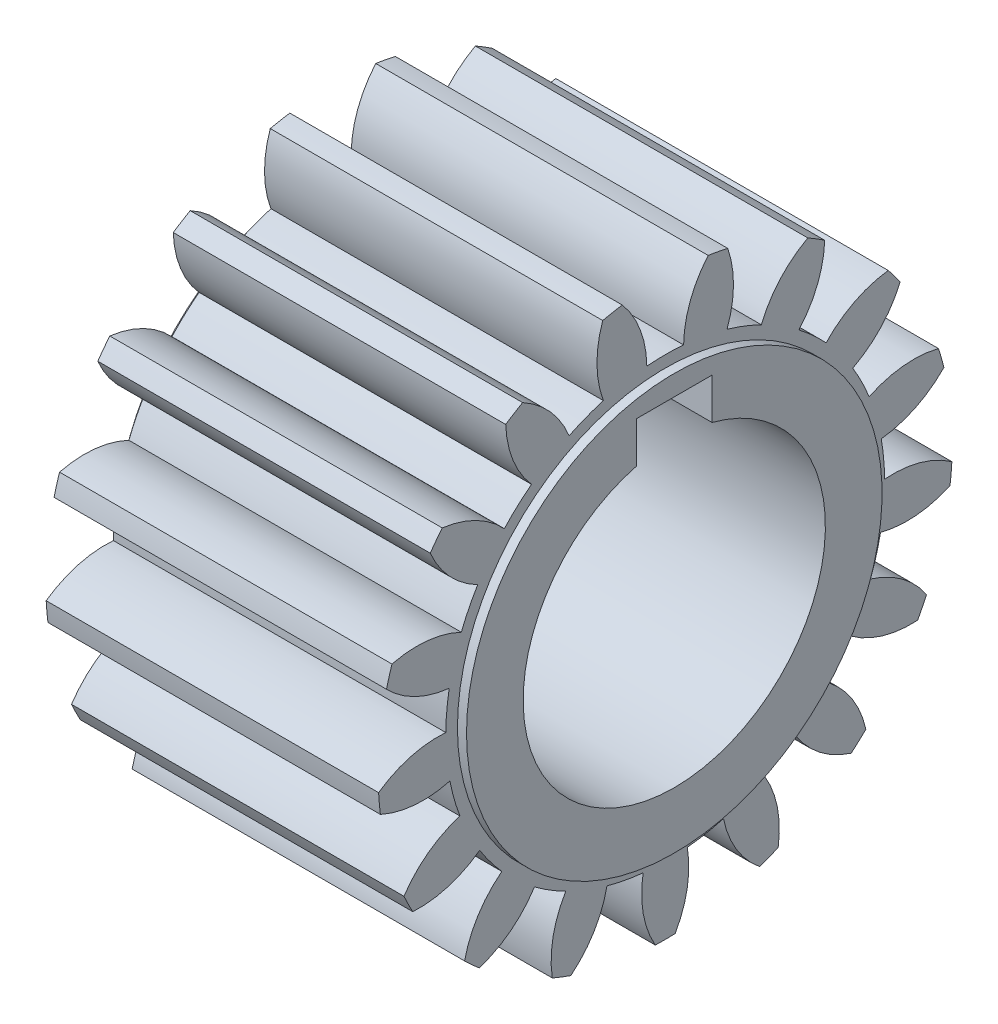
from build123d import *

# Parameters (mm, degrees)
SPUR_START          = 60.68508869
SPUR_GEAR_AI_DEPTH  = 13.97
SKETCH1_R           = 8.73125
BOSS_EXTRUDE1_DEPTH = 0.381
BOSS_EXTRUDE2_START = 0.381
SKETCH2_R           = 8.73125
BOSS_EXTRUDE2_DEPTH = 0.381


# Read off the part's stored shape, not the designer's step: spur gear_ai
with BuildPart() as part:
    # spur gear_ai outline → spur gear_ai (new body)
    with BuildSketch(Plane.YZ.offset(SPUR_START)):
        with BuildLine():
            ThreePointArc((-11.323917399, -24.217086363), (-11.097675416, -23.865456059), (-10.883753605, -23.506197427))
            ThreePointArc((-10.883753605, -23.506197427), (-11.804950291, -22.339121223), (-13.067398654, -21.553695012))
            ThreePointArc((-13.067398654, -21.553695012), (-12.757964709, -20.844772424), (-12.509041094, -20.112408009))
            ThreePointArc((-12.509041094, -20.112408009), (-11.04694228, -20.382476998), (-9.57991556, -20.14060347))
            ThreePointArc((-9.57991556, -20.14060347), (-9.495974711, -19.730989946), (-9.42627775, -19.318713778))
            ThreePointArc((-9.42627775, -19.318713778), (-10.70686463, -18.563222253), (-12.167791342, -18.286883074))
            ThreePointArc((-12.167791342, -18.286883074), (-12.135345159, -17.514052013), (-12.167791342, -16.741220953))
            ThreePointArc((-12.167791342, -16.741220953), (-10.70686463, -16.464881774), (-9.42627775, -15.709390249))
            ThreePointArc((-9.42627775, -15.709390249), (-9.495974711, -15.297114081), (-9.57991556, -14.887500557))
            ThreePointArc((-9.57991556, -14.887500557), (-11.04694228, -14.645627029), (-12.509041094, -14.915696018))
            ThreePointArc((-12.509041094, -14.915696018), (-12.757964709, -14.183331603), (-13.067398654, -13.474409015))
            ThreePointArc((-13.067398654, -13.474409015), (-11.804950291, -12.688982804), (-10.883753605, -11.5219066))
            ThreePointArc((-10.883753605, -11.5219066), (-11.097675416, -11.162647968), (-11.323917399, -10.811017664))
            ThreePointArc((-11.323917399, -10.811017664), (-12.779253872, -11.115428493), (-14.045060241, -11.895431337))
            ThreePointArc((-14.045060241, -11.895431337), (-14.54173514, -11.302443439), (-15.086366078, -10.753173247))
            ThreePointArc((-15.086366078, -10.753173247), (-14.192896711, -9.564736168), (-13.755502936, -8.143695392))
            ThreePointArc((-13.755502936, -8.143695392), (-14.084758271, -7.885974166), (-14.422746154, -7.639816704))
            ThreePointArc((-14.422746154, -7.639816704), (-15.669841124, -8.44939952), (-16.568400884, -9.633992513))
            ThreePointArc((-16.568400884, -9.633992513), (-17.245748371, -9.260467435), (-17.952020875, -8.945031621))
            ThreePointArc((-17.952020875, -8.945031621), (-17.548198493, -7.514088685), (-17.653680083, -6.031002769))
            ThreePointArc((-17.653680083, -6.031002769), (-18.053801184, -5.909625629), (-18.45788783, -5.802185936))
            ThreePointArc((-18.45788783, -5.802185936), (-19.328314212, -7.007602095), (-19.738271888, -8.436799389))
            ThreePointArc((-19.738271888, -8.436799389), (-20.504812431, -8.333183761), (-21.277340486, -8.294183681))
            ThreePointArc((-21.277340486, -8.294183681), (-21.41770354, -6.813991662), (-22.051814621, -5.469159576))
            ThreePointArc((-22.051814621, -5.469159576), (-22.468762916, -5.500519177), (-22.884374185, -5.546307581))
            ThreePointArc((-22.884374185, -5.546307581), (-23.260576072, -6.98475895), (-23.126564609, -8.465539531))
            ThreePointArc((-23.126564609, -8.465539531), (-23.87877266, -8.645827218), (-24.613222072, -8.888530048))
            ThreePointArc((-24.613222072, -8.888530048), (-25.278813753, -7.55899708), (-26.355914109, -6.53404585))
            ThreePointArc((-26.355914109, -6.53404585), (-26.733378421, -6.713906903), (-27.104383709, -6.906739426))
            ThreePointArc((-27.104383709, -6.906739426), (-26.935552952, -8.383955178), (-26.275671339, -9.716331423))
            ThreePointArc((-26.275671339, -9.716331423), (-26.911957033, -10.156173575), (-27.509136339, -10.647800953))
            ThreePointArc((-27.509136339, -10.647800953), (-28.610064803, -9.648487829), (-29.984686063, -9.081842798))
            ThreePointArc((-29.984686063, -9.081842798), (-30.271687745, -9.385914073), (-30.547980731, -9.699747614))
            ThreePointArc((-30.547980731, -9.699747614), (-29.856918859, -11.016221575), (-28.760287766, -12.020248689))
            ThreePointArc((-28.760287766, -12.020248689), (-29.194717194, -12.660242185), (-29.573974019, -13.33439711))
            ThreePointArc((-29.573974019, -13.33439711), (-30.961552776, -12.800266607), (-32.448044722, -12.768456326))
            ThreePointArc((-32.448044722, -12.768456326), (-32.605822607, -13.155671311), (-32.750088392, -13.548120911))
            ThreePointArc((-32.750088392, -13.548120911), (-31.63012714, -14.526055979), (-30.244852672, -15.066134537))
            ThreePointArc((-30.244852672, -15.066134537), (-30.418753733, -15.819844709), (-30.528867342, -16.585478823))
            ThreePointArc((-30.528867342, -16.585478823), (-32.015696192, -16.588668223), (-33.41329985, -17.095988847))
            ThreePointArc((-33.41329985, -17.095988847), (-33.420545159, -17.514052013), (-33.41329985, -17.93211518))
            ThreePointArc((-33.41329985, -17.93211518), (-32.015696192, -18.439435804), (-30.528867342, -18.442625204))
            ThreePointArc((-30.528867342, -18.442625204), (-30.418753733, -19.208259318), (-30.244852672, -19.96196949))
            ThreePointArc((-30.244852672, -19.96196949), (-31.63012714, -20.502048048), (-32.750088392, -21.479983116))
            ThreePointArc((-32.750088392, -21.479983116), (-32.605822607, -21.872432716), (-32.448044722, -22.259647701))
            ThreePointArc((-32.448044722, -22.259647701), (-30.961552776, -22.22783742), (-29.573974019, -21.693706917))
            ThreePointArc((-29.573974019, -21.693706917), (-29.194717194, -22.367861842), (-28.760287766, -23.007855338))
            ThreePointArc((-28.760287766, -23.007855338), (-29.856918859, -24.011882452), (-30.547980731, -25.328356413))
            ThreePointArc((-30.547980731, -25.328356413), (-30.271687745, -25.642189954), (-29.984686063, -25.946261229))
            ThreePointArc((-29.984686063, -25.946261229), (-28.610064803, -25.379616198), (-27.509136339, -24.380303074))
            ThreePointArc((-27.509136339, -24.380303074), (-26.911957033, -24.871930452), (-26.275671339, -25.311772604))
            ThreePointArc((-26.275671339, -25.311772604), (-26.935552952, -26.644148849), (-27.104383709, -28.121364601))
            ThreePointArc((-27.104383709, -28.121364601), (-26.733378421, -28.314197124), (-26.355914109, -28.494058177))
            ThreePointArc((-26.355914109, -28.494058177), (-25.278813753, -27.469106947), (-24.613222072, -26.139573979))
            ThreePointArc((-24.613222072, -26.139573979), (-23.87877266, -26.382276809), (-23.126564609, -26.562564496))
            ThreePointArc((-23.126564609, -26.562564496), (-23.260576072, -28.043345077), (-22.884374185, -29.481796446))
            ThreePointArc((-22.884374185, -29.481796446), (-22.468762916, -29.527584851), (-22.051814621, -29.558944451))
            ThreePointArc((-22.051814621, -29.558944451), (-21.41770354, -28.214112365), (-21.277340486, -26.733920346))
            ThreePointArc((-21.277340486, -26.733920346), (-20.504812431, -26.694920266), (-19.738271888, -26.591304638))
            ThreePointArc((-19.738271888, -26.591304638), (-19.328314212, -28.020501932), (-18.45788783, -29.225918091))
            ThreePointArc((-18.45788783, -29.225918091), (-18.053801184, -29.118478398), (-17.653680083, -28.997101258))
            ThreePointArc((-17.653680083, -28.997101258), (-17.548198493, -27.514015342), (-17.952020875, -26.083072406))
            ThreePointArc((-17.952020875, -26.083072406), (-17.245748371, -25.767636592), (-16.568400884, -25.394111514))
            ThreePointArc((-16.568400884, -25.394111514), (-15.669841124, -26.578704507), (-14.422746154, -27.388287323))
            ThreePointArc((-14.422746154, -27.388287323), (-14.084758271, -27.142129861), (-13.755502936, -26.884408635))
            ThreePointArc((-13.755502936, -26.884408635), (-14.192896711, -25.463367859), (-15.086366078, -24.27493078))
            ThreePointArc((-15.086366078, -24.27493078), (-14.54173514, -23.725660588), (-14.045060241, -23.13267269))
            ThreePointArc((-14.045060241, -23.13267269), (-12.779253872, -23.912675534), (-11.323917399, -24.217086363))
        make_face()
        with BuildLine():
            Line((-13.481545159, -19.101552014), (-15.207184097, -19.101552014))
            ThreePointArc((-15.207184097, -19.101552014), (-27.705545159, -17.514052014), (-15.207184097, -15.926552014))
            Line((-15.207184097, -15.926552014), (-13.481545159, -15.926552014))
            Line((-13.481545159, -15.926552014), (-13.481545159, -19.101552014))
        make_face(mode=Mode.SUBTRACT)
    extrude(amount=SPUR_GEAR_AI_DEPTH)

    # Sketch1 → Boss-Extrude1 (add)
    with BuildSketch(Plane(origin=(74.65508869, 0, 0), x_dir=(0, 0, -1), z_dir=(1, 0, 0))):
        with Locations(Location((17.514052014, -21.355545159, 0), (0, 0, 180))):
            Circle(SKETCH1_R)
        with BuildLine():
            Line((15.926552014, -13.481545159), (15.926552014, -15.207184097))
            ThreePointArc((15.926552014, -15.207184097), (17.514052014, -27.705545159), (19.101552014, -15.207184097))
            Line((19.101552014, -15.207184097), (19.101552014, -13.481545159))
            Line((19.101552014, -13.481545159), (15.926552014, -13.481545159))
        make_face(mode=Mode.SUBTRACT)
    extrude(amount=BOSS_EXTRUDE1_DEPTH)

    # Sketch2 → Boss-Extrude2 (add)
    with BuildSketch(Plane.ZY.offset(-60.68508869).offset(BOSS_EXTRUDE2_START)):
        with Locations((-17.514052014, -21.355545159)):
            Circle(SKETCH2_R)
        with BuildLine():
            Line((-19.101552014, -13.481545159), (-19.101552014, -15.207184097))
            ThreePointArc((-19.101552014, -15.207184097), (-17.514052014, -27.705545159), (-15.926552014, -15.207184097))
            Line((-15.926552014, -15.207184097), (-15.926552014, -13.481545159))
            Line((-15.926552014, -13.481545159), (-19.101552014, -13.481545159))
        make_face(mode=Mode.SUBTRACT)
    extrude(amount=-BOSS_EXTRUDE2_DEPTH)


solid = part.part
